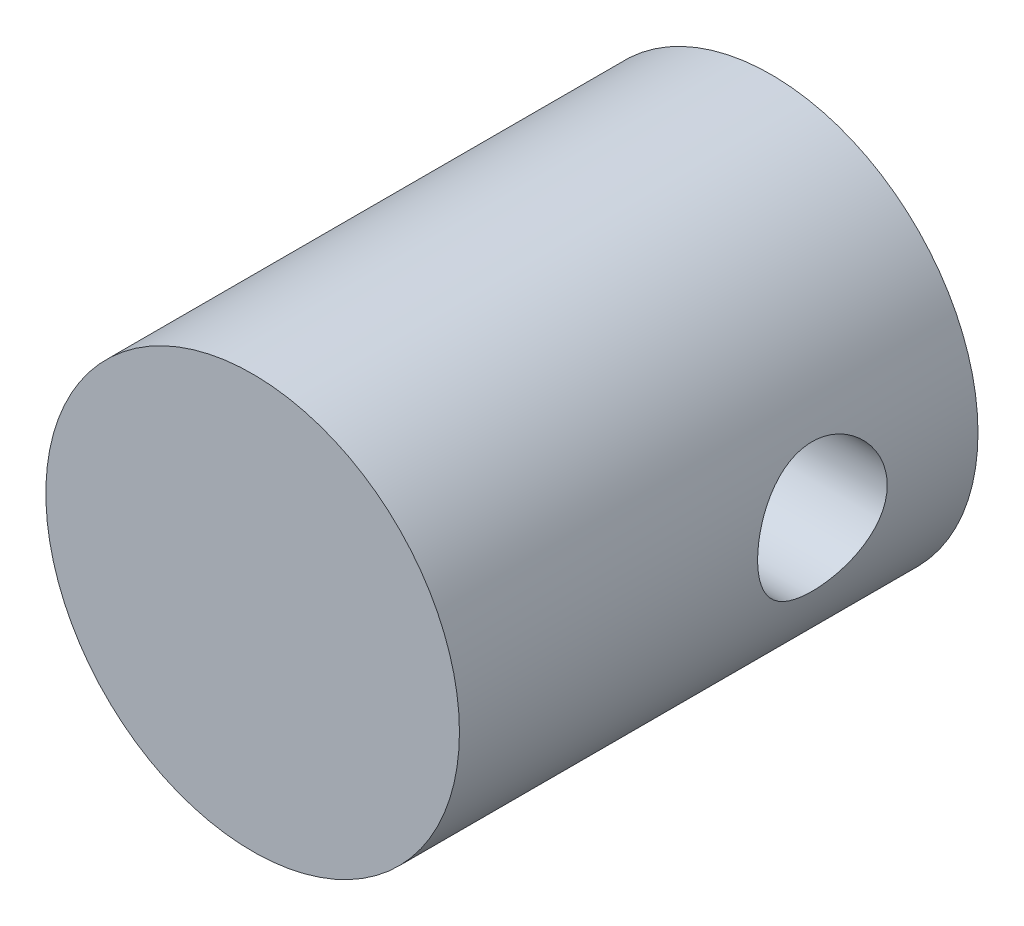
from build123d import *

# Parameters (mm, degrees)
SKETCH1_R               = 12.6619
BOSS_EXTRUDE1_DEPTH     = 31.75
CUT_EXTRUDE1_DEPTH      = 37.45147354
CUT_EXTRUDE1_DEPTH_BACK = 37.45147354
SKETCH2_R               = 3.96875


with BuildPart() as part:
    # Sketch1 → Boss-Extrude1 (new body)
    with BuildSketch(Plane(origin=(0, 0, 0), x_dir=(0, 1, 0), z_dir=(0, 0, 1))):
        Circle(SKETCH1_R)
    extrude(amount=BOSS_EXTRUDE1_DEPTH)

    # Sketch2 → Cut-Extrude1 (cut, two sides: drawn at the far end of the back side and taken through both)
    with BuildSketch(Plane.YZ.offset(-CUT_EXTRUDE1_DEPTH_BACK)):
        with Locations((0, 9.525)):
            Circle(SKETCH2_R)
    extrude(amount=CUT_EXTRUDE1_DEPTH + CUT_EXTRUDE1_DEPTH_BACK, mode=Mode.SUBTRACT)


solid = part.part
